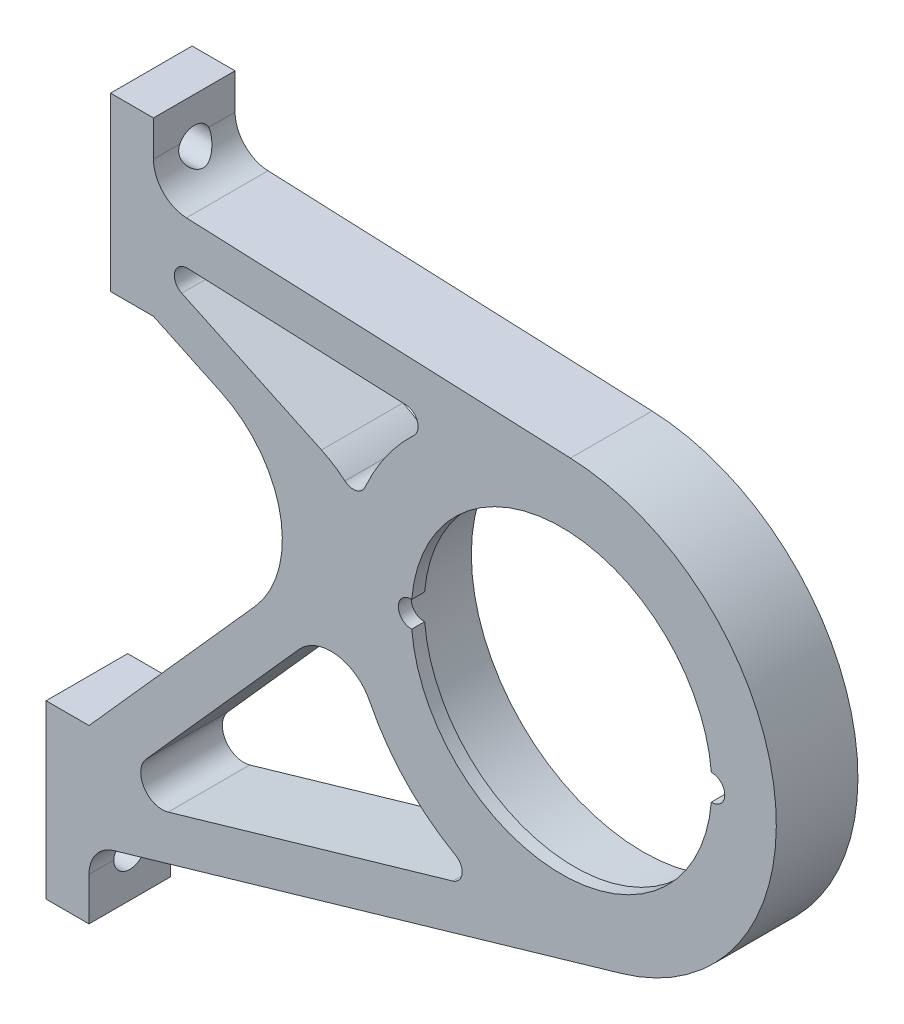
from build123d import *

# Parameters (mm, degrees)
SKETCH1_R           = 50.8
BOSS_EXTRUDE1_DEPTH = 24.13
FILLET1_R           = 10.16
SKETCH2_R           = 4.7625
CUT_EXTRUDE1_DEPTH  = 252.642736633
BOSS_EXTRUDE2_START = -3.81
SKETCH3_R           = 50.8
BOSS_EXTRUDE2_DEPTH = 3.81


with BuildPart() as part:
    # Sketch1 → Boss-Extrude1 (new body)
    with BuildSketch(Plane.XY):
        with BuildLine():
            Line((-133.35, 88.9), (-133.35, 38.1))
            Line((-133.35, 38.1), (-120.65, 38.1))
            Line((-120.65, 38.1), (-100.755098441, 28.715816927))
            ThreePointArc((-100.755098441, 28.715816927), (-83.188973521, 6.337707108), (-90.601125221, -21.128791593))
            Line((-90.601125221, -21.128791593), (-139.7, -76.2))
            Line((-139.7, -76.2), (-152.4, -76.2))
            Line((-152.4, -76.2), (-152.4, -127))
            Line((-152.4, -127), (-139.7, -127))
            Line((-139.7, -127), (-139.7, -106.68))
            Line((-139.7, -106.68), (17.704429235, -60.981990665))
            ThreePointArc((17.704429235, -60.981990665), (63.039807772, 7.631031129), (2.642419241, 63.444996813))
            Line((2.642419241, 63.444996813), (-120.65, 68.58))
            Line((-120.65, 68.58), (-120.65, 88.9))
            Line((-120.65, 88.9), (-133.35, 88.9))
        make_face()
        Circle(SKETCH1_R, mode=Mode.SUBTRACT)
        with BuildLine():
            Line((-46.037431664, 52.76145265), (-110.49514893, 55.446050662))
            ThreePointArc((-110.49514893, 55.446050662), (-114.353417179, 52.549377789), (-112.279082271, 48.193452823))
            Line((-112.279082271, 48.193452823), (-70.985594525, 28.715816927))
            ThreePointArc((-70.985594525, 28.715816927), (-67.368742902, 26.71210826), (-64.042949916, 24.25536955))
            ThreePointArc((-64.042949916, 24.25536955), (-60.727043781, 23.453741785), (-58.09853243, 25.628314996))
            ThreePointArc((-58.09853243, 25.628314996), (-51.868282156, 36.632380569), (-43.581110206, 46.183729096))
            ThreePointArc((-43.581110206, 46.183729096), (-42.626724096, 50.287620053), (-46.037431664, 52.76145265))
        make_face(mode=Mode.SUBTRACT)
        with BuildLine():
            Line((-77.6210071, -25.653934719), (-122.808045193, -76.337474888))
            ThreePointArc((-122.808045193, -76.337474888), (-123.43951378, -83.950303149), (-116.297827314, -86.661432273))
            Line((-116.297827314, -86.661432273), (-32.118533433, -62.222309585))
            ThreePointArc((-32.118533433, -62.222309585), (-29.396609186, -59.006115837), (-31.302640742, -55.248481269))
            ThreePointArc((-31.302640742, -55.248481269), (-46.04089289, -43.731981225), (-56.784547657, -28.421209464))
            ThreePointArc((-56.784547657, -28.421209464), (-66.469460728, -21.515994345), (-77.6210071, -25.653934719))
        make_face(mode=Mode.SUBTRACT)
    extrude(amount=BOSS_EXTRUDE1_DEPTH)

    # Fillet1
    fillet1_edges = [part.edges().sort_by_distance(p)[0] for p in [
        (-139.7, -106.68, 12.065),
        (-120.65, 68.58, 12.065),
    ]]
    fillet(fillet1_edges, radius=FILLET1_R)

    # Sketch2 → Cut-Extrude1 (cut, through all)
    with BuildSketch(Plane.ZY.offset(152.4)):
        with Locations((12.065, -114.3)):
            Circle(SKETCH2_R)
        with Locations((12.065, 76.2)):
            Circle(SKETCH2_R)
    extrude(amount=-CUT_EXTRUDE1_DEPTH, mode=Mode.SUBTRACT)

    # Sketch3 → Boss-Extrude2 (add)
    with BuildSketch(Plane.XY.offset(24.13).offset(BOSS_EXTRUDE2_START)):
        Circle(SKETCH3_R)
        with BuildLine():
            ThreePointArc((44.286714286, -3.806499412), (0, -44.45), (-44.286714286, -3.806499412))
            ThreePointArc((-44.286714286, -3.806499412), (-48.26, 0), (-44.286714286, 3.806499412))
            ThreePointArc((-44.286714286, 3.806499412), (0, 44.45), (44.286714286, 3.806499412))
            ThreePointArc((44.286714286, 3.806499412), (48.26, 0), (44.286714286, -3.806499412))
        make_face(mode=Mode.SUBTRACT)
    extrude(amount=BOSS_EXTRUDE2_DEPTH)


solid = part.part
